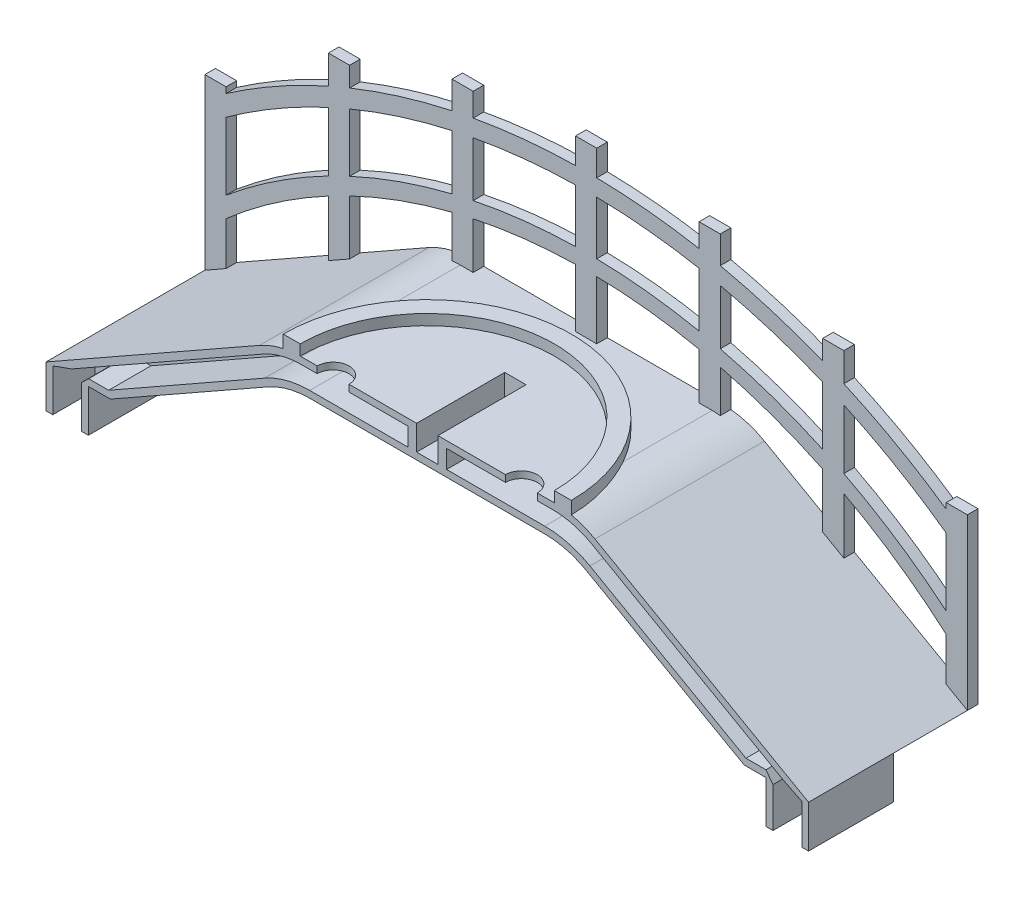
from build123d import *

# Parameters (mm, degrees)
BOSS_EXTRUDE1_DEPTH      = 12.7
BOSS_EXTRUDE2_DEPTH      = 0.79375
SKETCH5_7_W              = 1.5875
SKETCH5_7_H              = 15.875
SKETCH5_7_H_2            = 12.7
BOSS_EXTRUDE6_DEPTH      = 0.79375
BOSS_EXTRUDE7_DEPTH      = 0.79375
CUT_EXTRUDE1_DEPTH       = 9.525
SKETCH8_W                = 1.6002
SKETCH8_H                = 6.604
CUT_EXTRUDE2_DEPTH       = 1.397
BOSS_EXTRUDE8_DEPTH      = 1.397
BOSS_EXTRUDE9_DEPTH      = 0.79375
BOSS_EXTRUDE9_DEPTH_BACK = 0.254
SKETCH12_W               = 3.175
SKETCH12_H               = 6.35
BOSS_EXTRUDE10_DEPTH     = 3.175
CUT_EXTRUDE3_DEPTH       = 3.175
CUT_EXTRUDE4_DEPTH       = 3.175


with BuildPart() as part:
    # Sketch5 → Boss-Extrude1 (new body)
    with BuildSketch(Plane.XY):
        with BuildLine():
            Line((4.825954128, 0), (16.633370684, 6.698280246))
            ThreePointArc((16.633370684, 6.698280246), (18.146365475, 7.314936507), (19.76662415, 7.525126915))
            Line((19.76662415, 7.525126915), (37.38337585, 7.525126915))
            ThreePointArc((37.38337585, 7.525126915), (39.003634525, 7.314936507), (40.516629316, 6.698280246))
            Line((40.516629316, 6.698280246), (52.324045872, 0))
            Line((52.324045872, 0), (57.15, 0))
            Line((57.15, 0), (41.145026812, 9.079530246))
            ThreePointArc((41.145026812, 9.079530246), (39.632032021, 9.696186507), (38.011773345, 9.906376915))
            Line((38.011773345, 9.906376915), (19.138226655, 9.906376915))
            ThreePointArc((19.138226655, 9.906376915), (17.517967979, 9.696186507), (16.004973188, 9.079530246))
            Line((16.004973188, 9.079530246), (0, 0))
            Line((0, 0), (4.825954128, 0))
        make_face()
    extrude(amount=BOSS_EXTRUDE1_DEPTH)



with BuildPart() as body_2:
    # Sketch5<4> → Boss-Extrude2 (new body)
    with BuildSketch(Plane.XY):
        with BuildLine():
            Line((0, 11.1125), (0, 9.525))
            ThreePointArc((0, 9.525), (28.575, 19.431376915), (57.15, 9.525))
            Line((57.15, 9.525), (57.15, 11.1125))
            ThreePointArc((57.15, 11.1125), (28.575, 20.68840641), (0, 11.1125))
        make_face()
    extrude(amount=BOSS_EXTRUDE2_DEPTH)

    # Sketch5<7> → Boss-Extrude6 (add)
    with BuildSketch(Plane.XY):
        with Locations((10.054166667, 10.790876356)):
            Rectangle(SKETCH5_7_W, SKETCH5_7_H)
        Polygon((0, 0), (1.5875, 0.90057972), (1.5875, 12.7), (0, 12.7), align=None)
        with Locations((19.314583333, 13.730561119)):
            Rectangle(SKETCH5_7_W, SKETCH5_7_H)
        with Locations((28.575, 14.668876915)):
            Rectangle(SKETCH5_7_W, SKETCH5_7_H)
        with Locations((37.835416667, 13.730561119)):
            Rectangle(SKETCH5_7_W, SKETCH5_7_H)
        with Locations((47.095833333, 10.790876356)):
            Rectangle(SKETCH5_7_W, SKETCH5_7_H)
        with Locations((56.35625, 6.35)):
            Rectangle(SKETCH5_7_W, SKETCH5_7_H_2)
    extrude(amount=BOSS_EXTRUDE6_DEPTH)


with BuildPart() as part_1:
    add(part.part)

    add(body_2.part)  # Boss-Extrude7 merges body 2
    # Sketch6 → Boss-Extrude7 (add)
    with BuildSketch(Plane(origin=(0, 0, 0), x_dir=(-1, 0, 0), z_dir=(0, 0, -1))):
        with BuildLine():
            Line((-57.15, 4.270423014), (-57.15, 2.682923014))
            ThreePointArc((-57.15, 2.682923014), (-28.575, 14.276750754), (0, 2.682923014))
            Line((0, 2.682923014), (0, 4.270423014))
            ThreePointArc((0, 4.270423014), (-28.575, 15.429974262), (-57.15, 4.270423014))
        make_face()
    extrude(amount=-BOSS_EXTRUDE7_DEPTH)

    # Sketch7 → Cut-Extrude1 (cut)
    with BuildSketch(Plane.XY.offset(12.7)):
        with BuildLine():
            Line((38.011773345, 9.398376915), (19.138226655, 9.398376915))
            ThreePointArc((19.138226655, 9.398376915), (19.09411207, 9.398210352), (19.05, 9.397710672))
            Line((19.05, 9.397710672), (19.05, 8.033126915))
            Line((19.05, 8.033126915), (19.76662415, 8.033126915))
            Line((19.76662415, 8.033126915), (37.38337585, 8.033126915))
            Line((37.38337585, 8.033126915), (38.1, 8.033126915))
            Line((38.1, 8.033126915), (38.1, 9.397710672))
            ThreePointArc((38.1, 9.397710672), (38.05588793, 9.398210352), (38.011773345, 9.398376915))
        make_face()
    extrude(amount=-CUT_EXTRUDE1_DEPTH, mode=Mode.SUBTRACT)

    # Sketch8 → Cut-Extrude2 (cut)
    with BuildSketch(Plane(origin=(0, 9.906376915, 0), x_dir=(1, 0, 0), z_dir=(0, 1, 0))):
        with BuildLine():
            Line((20.328851655, -12.7), (22.710101655, -12.7))
            ThreePointArc((22.710101655, -12.7), (21.519476655, -11.509375), (20.328851655, -12.7))
        make_face()
        with BuildLine():
            ThreePointArc((36.821148345, -12.7), (35.630523345, -11.509375), (34.439898345, -12.7))
            Line((34.439898345, -12.7), (36.821148345, -12.7))
        make_face()
        with Locations((28.575, -9.398)):
            Rectangle(SKETCH8_W, SKETCH8_H)
    extrude(amount=-CUT_EXTRUDE2_DEPTH, mode=Mode.SUBTRACT)

    # Sketch10 → Boss-Extrude8 (add)
    with BuildSketch(Plane(origin=(0, 8.033126915, 0), x_dir=(1, 0, 0), z_dir=(0, 1, 0))):
        Polygon((29.3751, -12.7), (30.025608395, -12.7), (30.025608395, -5.496745829), (27.124391605, -5.496745829), (27.124391605, -12.7), (27.7749, -12.7), (27.7749, -6.096), (29.3751, -6.096), align=None)
    extrude(amount=BOSS_EXTRUDE8_DEPTH)

    # Sketch11 → Boss-Extrude9 (add, two sides: drawn at the far end of the back side and taken through both)
    with BuildSketch(Plane(origin=(0, 9.906376915, 0), x_dir=(1, 0, 0), z_dir=(0, 1, 0)).offset(-BOSS_EXTRUDE9_DEPTH_BACK)):
        with BuildLine():
            Line((17.78, -12.7), (19.05, -12.7))
            ThreePointArc((19.05, -12.7), (28.575, -3.175), (38.1, -12.7))
            Line((38.1, -12.7), (39.37, -12.7))
            ThreePointArc((39.37, -12.7), (28.575, -1.905), (17.78, -12.7))
        make_face()
    extrude(amount=BOSS_EXTRUDE9_DEPTH + BOSS_EXTRUDE9_DEPTH_BACK)

    # Sketch12 → Boss-Extrude10 (add)
    with BuildSketch(Plane.XZ):
        with Locations((1.5875, 9.525)):
            Rectangle(SKETCH12_W, SKETCH12_H)
        with Locations((55.5625, 9.525)):
            Rectangle(SKETCH12_W, SKETCH12_H)
    extrude(amount=BOSS_EXTRUDE10_DEPTH)

    # Sketch7<4> → Cut-Extrude3 (cut)
    with BuildSketch(Plane.XY.offset(12.7)):
        with BuildLine():
            Line((19.05, 8.033126915), (19.05, 9.397710672))
            ThreePointArc((19.05, 9.397710672), (17.604976819, 9.193584463), (16.255633466, 8.63767798))
            Line((16.255633466, 8.63767798), (1.925015629, 0.508))
            Line((1.925015629, 0.508), (4.691895996, 0.508))
            Line((4.691895996, 0.508), (16.382710407, 7.140132513))
            ThreePointArc((16.382710407, 7.140132513), (18.016744781, 7.806121275), (19.76662415, 8.033126915))
            Line((19.76662415, 8.033126915), (19.05, 8.033126915))
        make_face()
        with BuildLine():
            ThreePointArc((40.894366534, 8.63767798), (39.545023181, 9.193584463), (38.1, 9.397710672))
            Line((38.1, 9.397710672), (38.1, 8.033126915))
            Line((38.1, 8.033126915), (37.38337585, 8.033126915))
            ThreePointArc((37.38337585, 8.033126915), (39.133255219, 7.806121275), (40.767289593, 7.140132513))
            Line((40.767289593, 7.140132513), (52.458104004, 0.508))
            Line((52.458104004, 0.508), (55.224984371, 0.508))
            Line((55.224984371, 0.508), (40.894366534, 8.63767798))
        make_face()
    extrude(amount=-CUT_EXTRUDE3_DEPTH, mode=Mode.SUBTRACT)

    # Sketch15 → Cut-Extrude4 (cut)
    with BuildSketch(Plane.XY.offset(12.7)):
        Polygon((1.925015629, 0.508), (0.508, 0), (0.508, -3.175), (2.667, -3.175), (2.667, 0), (3.195015629, 0.508), align=None)
        Polygon((55.224984371, 0.508), (56.642, -0.194342167), (56.642, -3.175), (54.483, -3.175), (54.483, -0.194342167), (53.954984371, 0.508), align=None)
    extrude(amount=-CUT_EXTRUDE4_DEPTH, mode=Mode.SUBTRACT)


solid = part_1.part
